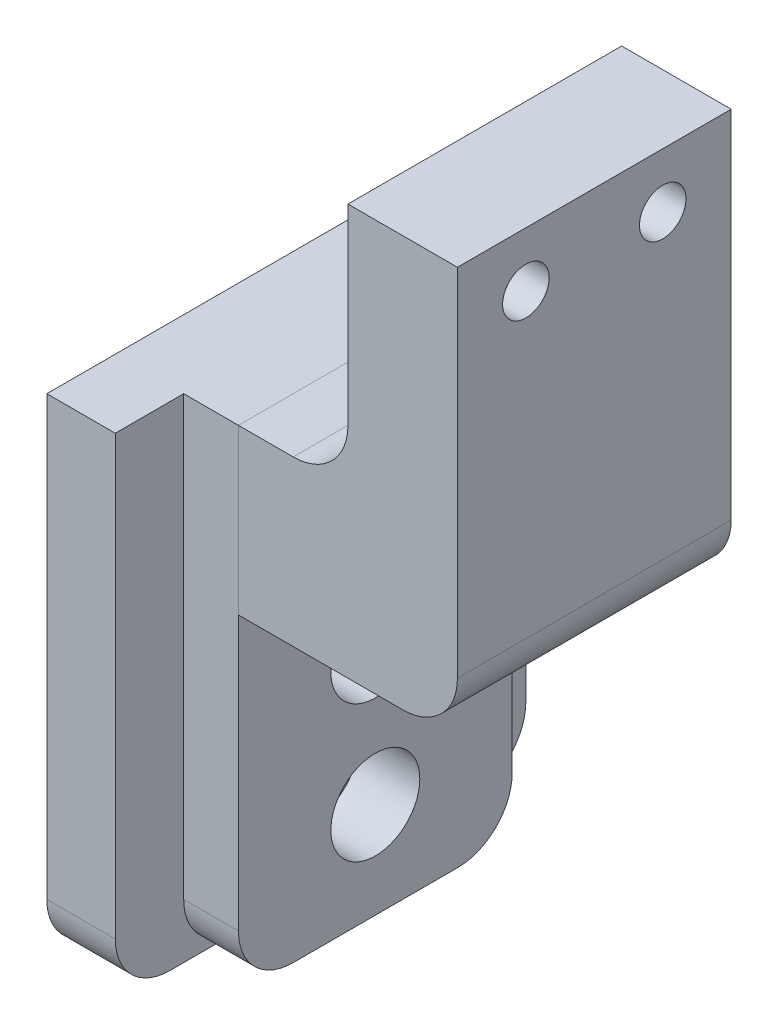
from build123d import *

# Parameters (mm, degrees)
BOSS_EXTRUDE1_DEPTH             = 10
BOSS_EXTRUDE2_DEPTH             = 6
BOSS_EXTRUDE2_DEPTH_BACK        = 30
BOSS_EXTRUDE4_START             = -8
SKETCH7_W                       = 20
SKETCH7_H                       = 10
BOSS_EXTRUDE4_DEPTH             = 8
CBORE_FOR_M3_SHCS11_D           = 3.4
CBORE_FOR_M3_SHCS11_CBORE_D     = 6.5
CBORE_FOR_M3_SHCS11_CBORE_DEPTH = 4.5
M3X0_5_TAPPED_HOLE1_D           = 2.5
M3X0_5_TAPPED_HOLE1_DEPTH       = 13.248924226
M3X0_5_TAPPED_HOLE1_TIP         = 0.751075774
FILLET3_R                       = 4
FILLET4_R                       = 4
CBORE_FOR_M3_SHCS13_D           = 3.4
CBORE_FOR_M3_SHCS13_DEPTH       = 20
CBORE_FOR_M3_SHCS13_CBORE_D     = 6.5
CBORE_FOR_M3_SHCS13_CBORE_DEPTH = 3
CBORE_FOR_M3_SHCS13_TIP         = 1.021463052


# Read off the part's stored shape, not the designer's step: CBORE for M3 SHCS12
with BuildPart() as part:
    # Sketch1 → Boss-Extrude1 (new, symmetric)
    with BuildSketch(Plane.XY):
        Polygon((16, -6), (0, -6), (0, 6), (8, 6), (8, 14), (16, 14), align=None)
    extrude(amount=BOSS_EXTRUDE1_DEPTH, both=True)

    # Sketch2 → Boss-Extrude2 (add, two sides: drawn at the far end of the back side and taken through both)
    with BuildSketch(Plane(origin=(0, 0, 0), x_dir=(1, 0, 0), z_dir=(0, 1, 0)).offset(-BOSS_EXTRUDE2_DEPTH_BACK)):
        Polygon((-4, 15), (-9, 15), (-9, -15), (-4, -15), (-4, -10), (0, -10), (0, 10), (-4, 10), align=None)
    extrude(amount=BOSS_EXTRUDE2_DEPTH + BOSS_EXTRUDE2_DEPTH_BACK)

    # Sketch7 → Boss-Extrude4 (add)
    with BuildSketch(Plane.ZY.offset(-8).offset(BOSS_EXTRUDE4_START)):
        with Locations((0, 19)):
            Rectangle(SKETCH7_W, SKETCH7_H)
    extrude(amount=BOSS_EXTRUDE4_DEPTH)

    # CBORE for M3 SHCS11 (through all)
    with Locations(Plane(origin=(0, 0, 0), x_dir=(0, 0, -1), z_dir=(1, 0, 0))):
        with Locations((0, -13), (0, -23)):
            CounterBoreHole(CBORE_FOR_M3_SHCS11_D / 2, CBORE_FOR_M3_SHCS11_CBORE_D / 2, CBORE_FOR_M3_SHCS11_CBORE_DEPTH)

    # M3x0.5 Tapped Hole1
    with Locations(Plane.ZY.offset(9)):
        with Locations((-5, 0), (5, 0)):
            Hole(M3X0_5_TAPPED_HOLE1_D / 2, depth=M3X0_5_TAPPED_HOLE1_DEPTH)
            with Locations((0, 0, -(M3X0_5_TAPPED_HOLE1_DEPTH + M3X0_5_TAPPED_HOLE1_TIP / 2))):  # 118° drill point
                Cone(0, M3X0_5_TAPPED_HOLE1_D / 2, M3X0_5_TAPPED_HOLE1_TIP, mode=Mode.SUBTRACT)

    # CBORE for M3 SHCS12 outline → CBORE for M3 SHCS12 (revolve, cut)
    with BuildSketch(Plane.YX.offset(-5)):
        Polygon((1.7, 0), (1.25, 0.270387279), (1.25, -9), (3.25, -9), (3.25, -4.5), (1.7, -4.5), align=None)
    revolve(axis=Axis((0, 0, 5), (1, 0, 0)), mode=Mode.SUBTRACT)

    # CBORE for M3 SHCS12 2 outline → CBORE for M3 SHCS12 2 (revolve, cut)
    with BuildSketch(Plane.YX.offset(5)):
        Polygon((1.25, -9), (3.25, -9), (3.25, -4.5), (1.7, -4.5), (1.7, 0), (1.25, 0.270387279), align=None)
    revolve(axis=Axis((0, 0, -5), (1, 0, 0)), mode=Mode.SUBTRACT)

    # Fillet3
    fillet3_edges = [part.edges().sort_by_distance(p)[0] for p in [
        (16, -6, 0),
        (8, 6, 0),
    ]]
    fillet(fillet3_edges, radius=FILLET3_R)

    # Fillet4
    fillet4_edges = [part.edges().sort_by_distance(p)[0] for p in [
        (-2, -30, -10),
        (-2, -30, 10),
        (-6.5, -30, 15),
        (-6.5, -30, -15),
    ]]
    fillet(fillet4_edges, radius=FILLET4_R)

    # CBORE for M3 SHCS13
    with Locations(Plane(origin=(8, -16.5, 0), x_dir=(0, 0, 1), z_dir=(-1, 0, 0))):
        with Locations((-5, 36.495), (5, 36.495)):
            CounterBoreHole(CBORE_FOR_M3_SHCS13_D / 2, CBORE_FOR_M3_SHCS13_CBORE_D / 2, CBORE_FOR_M3_SHCS13_CBORE_DEPTH, depth=CBORE_FOR_M3_SHCS13_DEPTH)
            with Locations((0, 0, -(CBORE_FOR_M3_SHCS13_DEPTH + CBORE_FOR_M3_SHCS13_TIP / 2))):  # 118° drill point
                Cone(0, CBORE_FOR_M3_SHCS13_D / 2, CBORE_FOR_M3_SHCS13_TIP, mode=Mode.SUBTRACT)


with BuildPart() as body_2:
    # Split1: the piece on the far side of the plane
    add(part.part)
    split(bisect_by=Plane(origin=(0, 0, 0), x_dir=(0, 0, 1), z_dir=(1, 0, 0)), keep=Keep.BOTTOM)


with BuildPart() as part_1:
    add(part.part)

    # Split1
    split(bisect_by=Plane(origin=(0, 0, 0), x_dir=(0, 0, 1), z_dir=(1, 0, 0)), keep=Keep.TOP)


solid = Compound([body_2.part, part_1.part])
